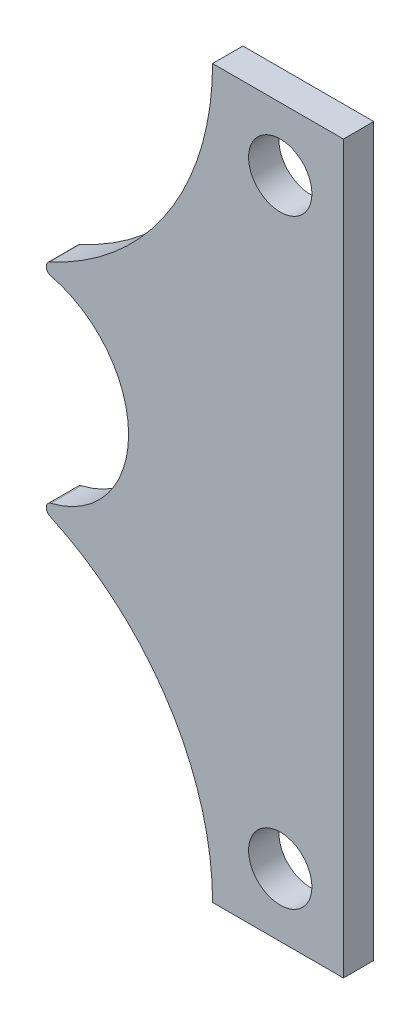
from build123d import *

# Parameters (mm, degrees)
SKETCH1_R           = 6.3627
BOSS_EXTRUDE1_DEPTH = 3.048
FILLET1_R           = 1.27


with BuildPart() as part:
    # Sketch1 → Boss-Extrude1 (new, symmetric)
    with BuildSketch(Plane.XY):
        with BuildLine():
            Line((-7.246114065, -73.025), (19.05, -73.025))
            Line((19.05, -73.025), (19.05, 73.025))
            Line((19.05, 73.025), (-7.246114065, 73.025))
            ThreePointArc((-7.246114065, 73.025), (-17.484032962, 40.768426431), (-44.45, 20.32))
            ThreePointArc((-44.45, 20.32), (-24.13, 0), (-44.45, -20.32))
            ThreePointArc((-44.45, -20.32), (-17.484032962, -40.768426431), (-7.246114065, -73.025))
        make_face()
        with Locations((6.35, -60.325)):
            Circle(SKETCH1_R, mode=Mode.SUBTRACT)
        with Locations((6.35, 60.325)):
            Circle(SKETCH1_R, mode=Mode.SUBTRACT)
    extrude(amount=BOSS_EXTRUDE1_DEPTH, both=True)

    # Fillet1
    fillet1_edges = [part.edges().sort_by_distance(p)[0] for p in [
        (-44.45, -20.32, 0),
        (-44.45, 20.32, 0),
    ]]
    fillet(fillet1_edges, radius=FILLET1_R)


solid = part.part
